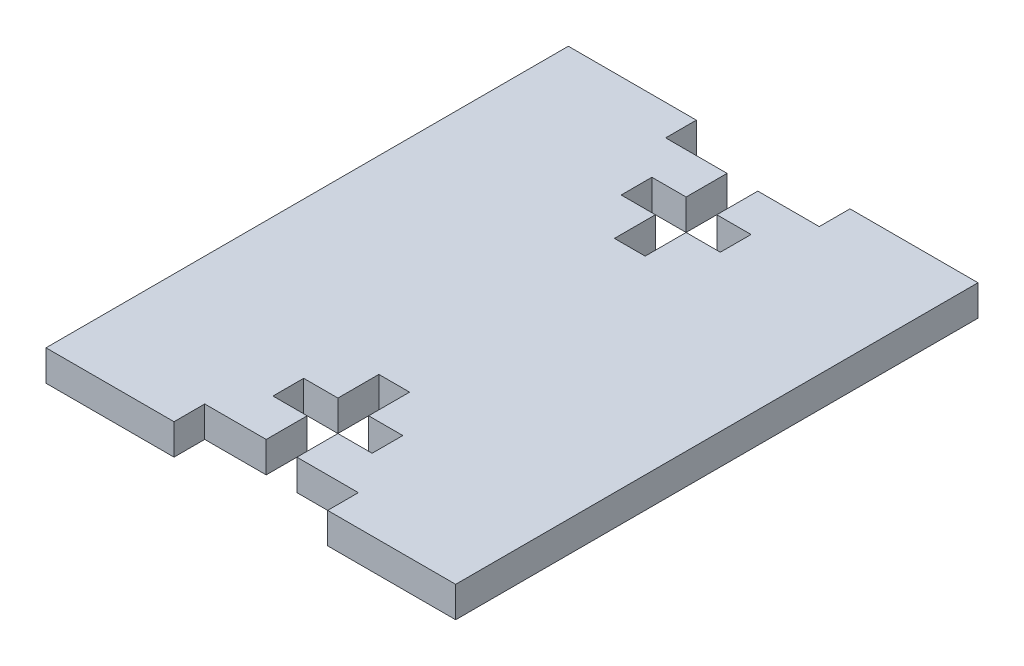
from build123d import *

# Parameters (mm, degrees)
SCHIZZO1_W                   = 40
SCHIZZO1_H                   = 51
ESTRUSIONE_ESTRUSIONE2_DEPTH = 3
SCHIZZO2_W                   = 15
SCHIZZO2_H                   = 3
TAGLIO_ESTRUSIONE1_DEPTH     = 62.531722929
TAGLIO_ESTRUSIONE3_DEPTH     = 62.531722929


with BuildPart() as part:
    # Schizzo1 → Estrusione-Estrusione2 (new body)
    with BuildSketch(Plane(origin=(0, 0, 0), x_dir=(1, 0, 0), z_dir=(0, 1, 0))):
        with Locations((-34.56494914, -2.781075862)):
            Rectangle(SCHIZZO1_W, SCHIZZO1_H)
    extrude(amount=-ESTRUSIONE_ESTRUSIONE2_DEPTH)

    # Schizzo2 → Taglio-Estrusione1 (cut, through all)
    with BuildSketch(Plane(origin=(0, 0, 0), x_dir=(1, 0, 0), z_dir=(0, 1, 0))):
        with Locations((-34.56494914, -26.781075862)):
            Rectangle(SCHIZZO2_W, SCHIZZO2_H)
        with Locations((-34.56494914, 21.218924138)):
            Rectangle(SCHIZZO2_W, SCHIZZO2_H)
    extrude(amount=-TAGLIO_ESTRUSIONE1_DEPTH, mode=Mode.SUBTRACT)

    # Schizzo3 → Taglio-Estrusione3 (cut, through all)
    with BuildSketch(Plane(origin=(0, 0, 0), x_dir=(1, 0, 0), z_dir=(0, 1, 0))):
        Polygon((-36.06494914, -25.281075862), (-33.06494914, -25.281075862), (-33.06494914, -21.281075862), (-29.72494914, -21.281075862), (-29.72494914, -18.281075862), (-33.06494914, -18.281075862), (-33.06494914, -14.281075862), (-36.06494914, -14.281075862), (-36.06494914, -18.281075862), (-39.40494914, -18.281075862), (-39.40494914, -21.281075862), (-36.06494914, -21.281075862), align=None)
        Polygon((-36.06494914, 8.718924138), (-33.06494914, 8.718924138), (-33.06494914, 12.718924138), (-29.72494914, 12.718924138), (-29.72494914, 15.718924138), (-33.06494914, 15.718924138), (-33.06494914, 19.718924138), (-36.06494914, 19.718924138), (-36.06494914, 15.718924138), (-39.40494914, 15.718924138), (-39.40494914, 12.718924138), (-36.06494914, 12.718924138), align=None)
    extrude(amount=-TAGLIO_ESTRUSIONE3_DEPTH, mode=Mode.SUBTRACT)


solid = part.part
